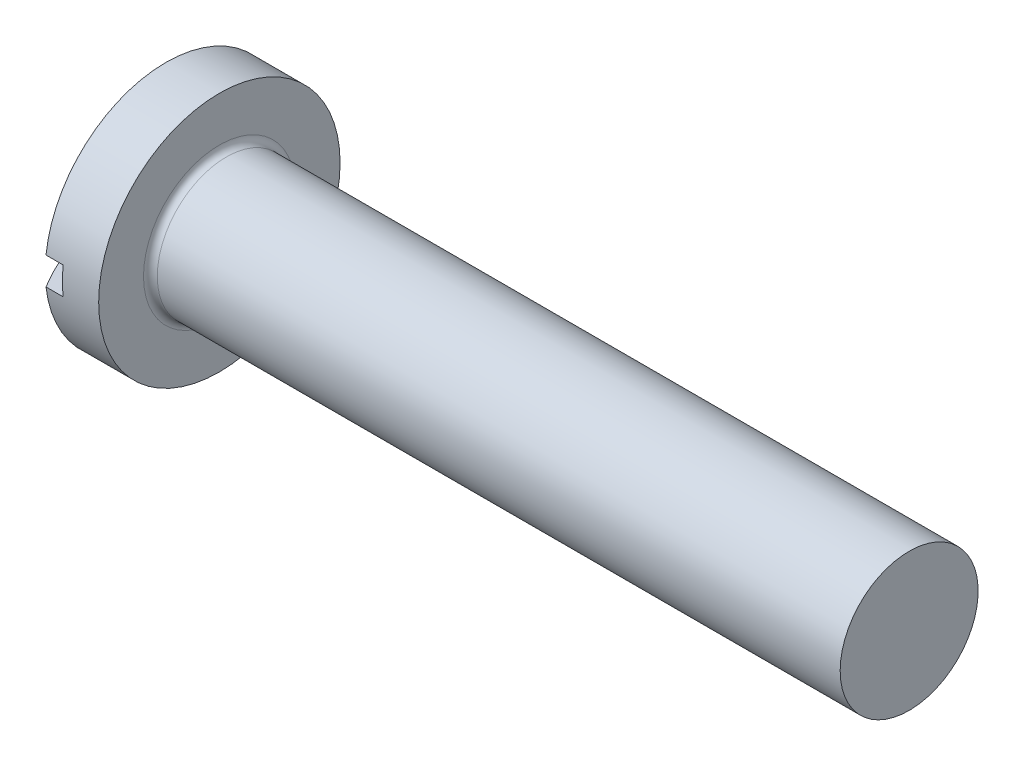
from build123d import *

# Parameters (mm, degrees)
FILLET1_R  = 0.4
SLOTSKE_W  = 14
SLOTSKE_H  = 1.6
SLOT_DEPTH = 3


with BuildPart() as part:
    # BodySke → BaseBody (revolve)
    with BuildSketch(Plane.XY):
        with BuildLine():
            Line((5.1, 7), (5.1, 4))
            Line((5.1, 4), (45.1, 4))
            Line((45.1, 4), (45.1, 0))
            Line((45.1, 0), (0, 0))
            ThreePointArc((0, 0), (0.509807694, 3.640054945), (2, 7))
            Line((2, 7), (5.1, 7))
        make_face()
    revolve(axis=Axis((0, 0, 0), (1, 0, 0)))

    # Fillet1
    fillet1_edges = [part.edges().sort_by_distance(p)[0] for p in [
        (5.1, -4, 0),
    ]]
    fillet(fillet1_edges, radius=FILLET1_R)

    # SlotSke → Slot (cut)
    with BuildSketch(Plane(origin=(0, 0, 0), x_dir=(0, 0, -1), z_dir=(1, 0, 0))):
        Rectangle(SLOTSKE_W, SLOTSKE_H)
    extrude(amount=SLOT_DEPTH, mode=Mode.SUBTRACT)


solid = part.part
